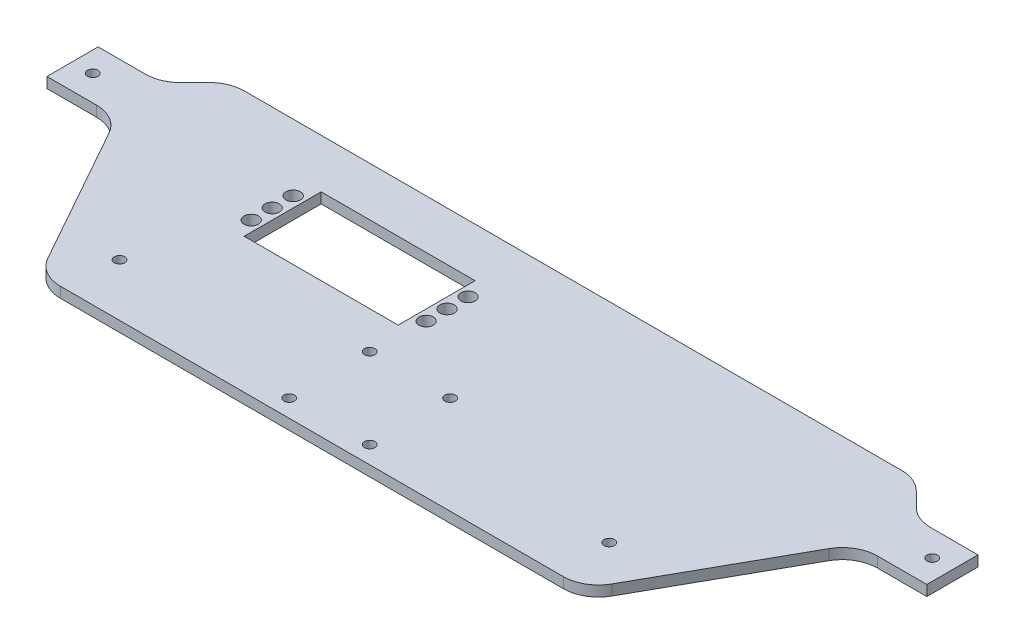
from build123d import *

# Parameters (mm, degrees)
SALIENTE_EXTRUIR1_DEPTH = 3
REDONDEO1_R             = 10
CROQUIS2_R              = 1.5
CROQUIS2_R_2            = 2.05
CROQUIS2_W              = 42
CROQUIS2_H              = 20
CORTAR_EXTRUIR1_DEPTH   = 135.610141171
CROQUIS3_W              = 4
CROQUIS3_H              = 14.636342218
CORTAR_EXTRUIR2_DEPTH   = 135.610141171
CROQUIS4_W              = 44
CROQUIS4_H              = 22
CORTAR_EXTRUIR3_DEPTH   = 131.820067673
CORTAR_EXTRUIR4_DEPTH   = 131.820067673
REDONDEO2_R             = 20
CORTAR_EXTRUIR5_DEPTH   = 10
REDONDEO3_R             = 10
CROQUIS7_W              = 14.636342218
CROQUIS7_H              = 3
SALIENTE_EXTRUIR2_DEPTH = 2
CROQUIS8_W              = 14.636342218
CROQUIS8_H              = 3
SALIENTE_EXTRUIR3_DEPTH = 2


with BuildPart() as part:
    # Croquis1 → Saliente-Extruir1 (new body)
    with BuildSketch(Plane(origin=(0, 0, 0), x_dir=(1, 0, 0), z_dir=(0, 1, 0))):
        Polygon((-88.1, 42.318171109), (88.1, 42.318171109), (108.1, 22.318171109), (127.75, 22.318171109), (127.75, 7.681828891), (105.75, 7.681828891), (77.75, -42.318171109), (-77.75, -42.318171109), (-105.75, 7.681828891), (-127.75, 7.681828891), (-127.75, 22.318171109), (-108.1, 22.318171109), align=None)
    extrude(amount=SALIENTE_EXTRUIR1_DEPTH)

    # Redondeo1
    redondeo1_edges = [part.edges().sort_by_distance(p)[0] for p in [
        (88.1, 1.5, -42.318171109),
        (-88.1, 1.5, -42.318171109),
        (-77.75, 1.5, 42.318171109),
        (77.75, 1.5, 42.318171109),
        (108.1, 1.5, -22.318171109),
        (105.75, 1.5, -7.681828891),
        (-105.75, 1.5, -7.681828891),
        (-108.1, 1.5, -22.318171109),
    ]]
    fillet(redondeo1_edges, radius=REDONDEO1_R)

    # Croquis2 → Cortar-Extruir1 (cut, through all)
    with BuildSketch(Plane(origin=(0, 3, 0), x_dir=(1, 0, 0), z_dir=(0, 1, 0))):
        with Locations((70, -27.318171109)):
            Circle(CROQUIS2_R)
        with Locations((-70, -27.318171109)):
            Circle(CROQUIS2_R)
        with Locations((-119.996067812, 15)):
            Circle(CROQUIS2_R)
        with Locations((119.996067812, 15)):
            Circle(CROQUIS2_R)
        with Locations((-11.5, -14.318171109)):
            Circle(CROQUIS2_R)
        with Locations((11.5, -14.318171109)):
            Circle(CROQUIS2_R)
        with Locations((-11.5, -37.318171109)):
            Circle(CROQUIS2_R)
        with Locations((11.5, -37.318171109)):
            Circle(CROQUIS2_R)
        with Locations((-61, 7.318171109)):
            Circle(CROQUIS2_R_2)
        with Locations((-11, 7.318171109)):
            Circle(CROQUIS2_R_2)
        with Locations((-61, 13.318171109)):
            Circle(CROQUIS2_R_2)
        with Locations((-61, 1.318171109)):
            Circle(CROQUIS2_R_2)
        with Locations((-11, 13.318171109)):
            Circle(CROQUIS2_R_2)
        with Locations((-11, 1.318171109)):
            Circle(CROQUIS2_R_2)
        with Locations((-36, 7.318171109)):
            Rectangle(CROQUIS2_W, CROQUIS2_H)
    extrude(amount=-CORTAR_EXTRUIR1_DEPTH, mode=Mode.SUBTRACT)

    # Croquis3 → Cortar-Extruir2 (cut, through all)
    with BuildSketch(Plane(origin=(0, 3, 0), x_dir=(1, 0, 0), z_dir=(0, 1, 0))):
        with Locations((-125.75, 15)):
            Rectangle(CROQUIS3_W, CROQUIS3_H)
        with Locations((125.75, 15)):
            Rectangle(CROQUIS3_W, CROQUIS3_H)
    extrude(amount=-CORTAR_EXTRUIR2_DEPTH, mode=Mode.SUBTRACT)

    # Croquis4 → Cortar-Extruir3 (cut, through all)
    with BuildSketch(Plane(origin=(0, 3, 0), x_dir=(1, 0, 0), z_dir=(0, 1, 0))):
        with Locations((-36, 7.318171109)):
            Rectangle(CROQUIS4_W, CROQUIS4_H)
    extrude(amount=-CORTAR_EXTRUIR3_DEPTH, mode=Mode.SUBTRACT)

    # Croquis5 → Cortar-Extruir4 (cut, through all)
    with BuildSketch(Plane(origin=(0, 3, 0), x_dir=(1, 0, 0), z_dir=(0, 1, 0))):
        Polygon((-63.75, 42.318171109), (-38.75, 32.318171109), (38.75, 32.318171109), (63.75, 42.318171109), align=None)
    extrude(amount=-CORTAR_EXTRUIR4_DEPTH, mode=Mode.SUBTRACT)

    # Redondeo2
    redondeo2_edges = [part.edges().sort_by_distance(p)[0] for p in [
        (63.75, 1.5, -42.318171109),
        (-63.75, 1.5, -42.318171109),
        (-38.75, 1.5, -32.318171109),
        (38.75, 1.5, -32.318171109),
    ]]
    fillet(redondeo2_edges, radius=REDONDEO2_R)

    # Croquis6 → Cortar-Extruir5 (cut)
    with BuildSketch(Plane(origin=(0, 3, 0), x_dir=(1, 0, 0), z_dir=(0, 1, 0))):
        Polygon((-34.898351929, 32.318171109), (-98.1, 32.318171109), (-98.1, 50.604425951), (105.42793471, 50.604425951), (105.42793471, 32.318171109), align=None)
    extrude(amount=-CORTAR_EXTRUIR5_DEPTH, mode=Mode.SUBTRACT)

    # Redondeo3
    redondeo3_edges = [part.edges().sort_by_distance(p)[0] for p in [
        (98.1, 1.5, -32.318171109),
        (-98.1, 1.5, -32.318171109),
    ]]
    fillet(redondeo3_edges, radius=REDONDEO3_R)

    # Croquis7 → Saliente-Extruir2 (add)
    with BuildSketch(Plane.ZY.offset(123.75)):
        with Locations((-15, 1.5)):
            Rectangle(CROQUIS7_W, CROQUIS7_H)
    extrude(amount=SALIENTE_EXTRUIR2_DEPTH)

    # Croquis8 → Saliente-Extruir3 (add)
    with BuildSketch(Plane(origin=(123.75, 0, 0), x_dir=(0, 0, -1), z_dir=(1, 0, 0))):
        with Locations((15, 1.5)):
            Rectangle(CROQUIS8_W, CROQUIS8_H)
    extrude(amount=SALIENTE_EXTRUIR3_DEPTH)


solid = part.part
